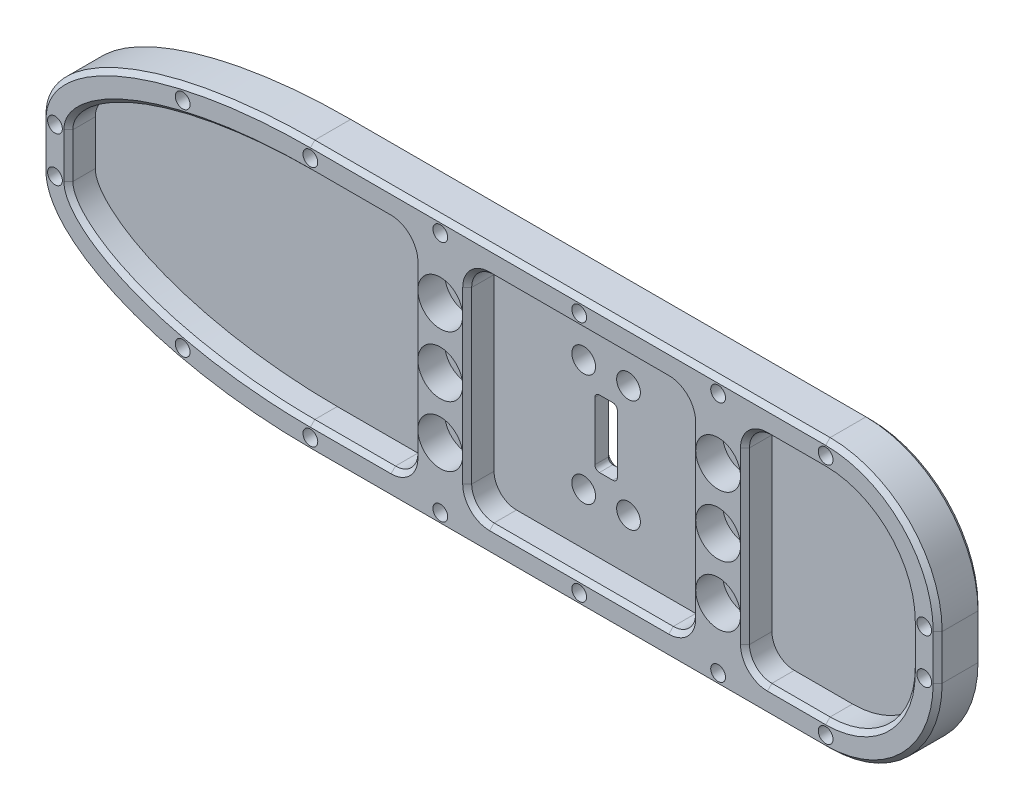
from build123d import *

# Parameters (mm, degrees)
SKETCH_1_W                = 200
SKETCH_1_H                = 60
SKETCH_1_W_2              = 12
SKETCH_1_H_2              = 33
SKETCH_1_W_3              = 5
SKETCH_1_H_3              = 15
EXTRUDE_1_DEPTH           = 10
FILLET_1_R                = 1
FILLET_2_R                = 25
FILLET_3_SIZE             = 60
FILLET_3_SIZE_2           = 25
EXTRUDE_START             = 8
EXTRUDE_2_DEPTH           = 8
SKETCH_3_W                = 50
SKETCH_3_H                = 48
CUT_EXTRUDE_1_DEPTH       = 6
HOLE_WIZARD_1_D           = 5.3
HOLE_WIZARD_1_CBORE_D     = 10
HOLE_WIZARD_1_CBORE_DEPTH = 6
FILLET_4_R                = 5
HOLE_WIZARD_M4_1_D        = 3.3
CHAMFER_1_SIZE            = 1
CHAMFER_2_SIZE            = 1
CHAMFER_3_SIZE            = 1
CUT_EXTRUDE_2_DEPTH       = 2
FILLET_5_R                = 5
CUT_EXTRUDE_4_DEPTH       = 2
FILLET_6_R                = 5
CHAMFER_4_SIZE            = 1
SKETCH_13_R               = 2.65
CUT_EXTRUDE_5_DEPTH       = 144.303873064


# Some blends are built 0.0001 mm under size
with BuildPart() as part:
    # 草图1 → 凸台-拉伸1 (new body)
    with BuildSketch(Plane.XY):
        with Locations((-40, 0)):
            Rectangle(SKETCH_1_W, SKETCH_1_H)
        with Locations((-51, 0)):
            Rectangle(SKETCH_1_W_2, SKETCH_1_H_2, mode=Mode.SUBTRACT)
        with Locations((11, 0)):
            Rectangle(SKETCH_1_W_2, SKETCH_1_H_2, mode=Mode.SUBTRACT)
        with Locations((-20, 0)):
            Rectangle(SKETCH_1_W_3, SKETCH_1_H_3, mode=Mode.SUBTRACT)
    extrude(amount=EXTRUDE_1_DEPTH)

    # 圆角1
    fillet_1_edges = [part.edges().sort_by_distance(p)[0] for p in [
        (-45, -16.5, 5),
        (-45, 16.5, 5),
        (-57, 16.5, 5),
        (-57, -16.5, 5),
        (17, -16.5, 5),
        (17, 16.5, 5),
        (5, 16.5, 5),
        (5, -16.5, 5),
        (-17.5, -7.5, 5),
        (-17.5, 7.5, 5),
        (-22.5, 7.5, 5),
        (-22.5, -7.5, 5),
    ]]
    fillet(fillet_1_edges, radius=FILLET_1_R)

    # 圆角2
    fillet_2_edges = [part.edges().sort_by_distance(p)[0] for p in [
        (60, 30, 5),
        (60, -30, 5),
    ]]
    fillet(fillet_2_edges, radius=FILLET_2_R)

    # 圆角3
    # an asymmetric fillet: 60, 25 mm, written as the material it takes off along each edge
    with BuildSketch(Plane(origin=(-140, -30, -150), x_dir=(1, 0, 0), z_dir=(0, 0, 1))) as fillet_3_piece_1:
        with BuildLine():
            Bezier((FILLET_3_SIZE, 0), (0, 0), (0, FILLET_3_SIZE_2), weights=[1, 0.707106781, 1])
            Line((0, FILLET_3_SIZE_2), (0, 0))
            Line((0, 0), (FILLET_3_SIZE, 0))
        make_face()
    extrude(amount=310, mode=Mode.SUBTRACT)
    with BuildSketch(Plane(origin=(-140, 30, -150), x_dir=(0, -1, 0), z_dir=(0, 0, 1))) as fillet_3_piece_2:
        with BuildLine():
            Bezier((FILLET_3_SIZE_2, 0), (0, 0), (0, FILLET_3_SIZE), weights=[1, 0.707106781, 1])
            Line((0, FILLET_3_SIZE), (0, 0))
            Line((0, 0), (FILLET_3_SIZE_2, 0))
        make_face()
    extrude(amount=310, mode=Mode.SUBTRACT)

    # 草图2 → 凸台-拉伸2 (add)
    with BuildSketch(Plane.XY.offset(2).offset(EXTRUDE_START)):
        with BuildLine():
            Line((6, -16.5), (16, -16.5))
            ThreePointArc((16, -16.5), (16.707106781, -16.207106781), (17, -15.5))
            Line((17, -15.5), (17, 15.5))
            ThreePointArc((17, 15.5), (16.707106781, 16.207106781), (16, 16.5))
            Line((16, 16.5), (6, 16.5))
            ThreePointArc((6, 16.5), (5.292893219, 16.207106781), (5, 15.5))
            Line((5, 15.5), (5, -15.5))
            ThreePointArc((5, -15.5), (5.292893219, -16.207106781), (6, -16.5))
        make_face()
        with BuildLine():
            Line((-45, -15.5), (-45, 15.5))
            ThreePointArc((-45, 15.5), (-45.292893219, 16.207106781), (-46, 16.5))
            Line((-46, 16.5), (-56, 16.5))
            ThreePointArc((-56, 16.5), (-56.707106781, 16.207106781), (-57, 15.5))
            Line((-57, 15.5), (-57, -15.5))
            ThreePointArc((-57, -15.5), (-56.707106781, -16.207106781), (-56, -16.5))
            Line((-56, -16.5), (-46, -16.5))
            ThreePointArc((-46, -16.5), (-45.292893219, -16.207106781), (-45, -15.5))
        make_face()
    extrude(amount=-EXTRUDE_2_DEPTH)

    # 草图3 → 切除-拉伸1 (cut)
    with BuildSketch(Plane.XY.offset(10)):
        with Locations((-20, 0)):
            Rectangle(SKETCH_3_W, SKETCH_3_H)
        with BuildLine():
            Line((-57, 24), (-57, -24))
            Line((-57, -24), (-80, -24))
            add(Edge.make_bspline(
                [(-134, -5), (-134, -5.321566696), (-133.966582352, -5.636753616), (-133.839255599, -6.255579006), (-133.74510808, -6.560649308), (-133.39233917, -7.452769053), (-133.075474111, -7.999573955), (-132.532172356, -8.779869491), (-132.338402095, -9.033829787), (-131.935590882, -9.525137652), (-131.726460148, -9.762430275), (-131.079728935, -10.453376525), (-130.622982271, -10.886307233), (-129.671462644, -11.711010802), (-129.176568621, -12.102652631), (-128.156534756, -12.853199661), (-127.633293959, -13.210532271), (-126.043805661, -14.232141245), (-124.953342805, -14.851558554), (-122.726072359, -15.997632455), (-121.589093234, -16.523945711), (-119.277989623, -17.502224395), (-118.102643683, -17.954494232), (-114.538012443, -19.216567996), (-112.137121221, -19.92641329), (-107.299831175, -21.15523768), (-104.862785448, -21.670739444), (-99.958093605, -22.53725482), (-97.490497947, -22.888539664), (-92.528938987, -23.449373735), (-90.03461426, -23.657415918), (-85.020155365, -23.93301747), (-82.510992182, -24), (-80, -24)],
                knots=[0, 0, 0, 0, 0.015625, 0.015625, 0.03125, 0.03125, 0.0625, 0.0625, 0.078125, 0.078125, 0.09375, 0.09375, 0.125, 0.125, 0.15625, 0.15625, 0.1875, 0.1875, 0.25, 0.25, 0.3125, 0.3125, 0.375, 0.375, 0.5, 0.5, 0.625, 0.625, 0.75, 0.75, 0.875, 0.875, 1, 1, 1, 1], degree=3))
            Line((-134, -5), (-134, 5))
            add(Edge.make_bspline(
                [(-80, 24), (-85.020965946, 24), (-90.014059644, 23.73229491), (-97.458109689, 22.89285334), (-99.932018808, 22.541571769), (-103.629774911, 21.888754838), (-104.860158911, 21.650005684), (-107.316069714, 21.125855356), (-108.540718915, 20.840564599), (-112.187022782, 19.912644301), (-114.588039567, 19.200214751), (-118.12990119, 17.944068394), (-119.300336479, 17.493344196), (-121.61577055, 16.511957603), (-122.759488431, 15.98170001), (-124.435290747, 15.117434598), (-124.987765122, 14.817595504), (-126.078764766, 14.191162489), (-126.618249739, 13.864013602), (-128.203308244, 12.841880038), (-129.216776231, 12.106615101), (-130.634196308, 10.875726542), (-131.08932355, 10.443829769), (-131.951888797, 9.520650276), (-132.357470532, 9.031626278), (-133.078011832, 7.995368985), (-133.39792506, 7.440105439), (-133.74463934, 6.561571019), (-133.83822288, 6.26036066), (-133.966947475, 5.635704804), (-134, 5.319252214), (-134, 5)],
                knots=[0, 0, 0, 0, 0.25, 0.25, 0.375, 0.375, 0.4375, 0.4375, 0.5, 0.5, 0.625, 0.625, 0.6875, 0.6875, 0.75, 0.75, 0.78125, 0.78125, 0.8125, 0.8125, 0.875, 0.875, 0.90625, 0.90625, 0.9375, 0.9375, 0.96875, 0.96875, 0.984375, 0.984375, 1, 1, 1, 1], degree=3))
            Line((-80, 24), (-57, 24))
        make_face()
        with BuildLine():
            Line((17, 24), (17, -24))
            Line((17, -24), (35, -24))
            ThreePointArc((35, -24), (48.435028843, -18.435028843), (54, -5))
            Line((54, -5), (54, 5))
            ThreePointArc((54, 5), (48.435028843, 18.435028843), (35, 24))
            Line((35, 24), (17, 24))
        make_face()
    extrude(amount=-CUT_EXTRUDE_1_DEPTH, mode=Mode.SUBTRACT)

    # 打孔尺寸(%根据)内六角圆柱头螺钉的类型1 (through all)
    with Locations(Plane.XY.offset(10)):
        with Locations((11.000000001, 13.5), (11.000000001, 0), (11.000000001, -13.5), (-50.999999999, -13.5), (-50.999999999, 0), (-50.999999999, 13.5)):
            CounterBoreHole(HOLE_WIZARD_1_D / 2, HOLE_WIZARD_1_CBORE_D / 2, HOLE_WIZARD_1_CBORE_DEPTH)

    # 圆角4
    fillet_4_edges = [part.edges().sort_by_distance(p)[0] for p in [
        (-57, 24, 7),
        (-57, -24, 7),
        (-45, -24, 7),
        (-45, 24, 7),
        (5, -24, 7),
        (5, 24, 7),
        (17, 24, 7),
        (17, -24, 7),
    ]]
    fillet(fillet_4_edges, radius=FILLET_4_R)

    # M4 螺纹孔1 (through all)
    with Locations(Plane.XY.offset(10)):
        with Locations((-137, 5), (-137, -5), (-108.5, -23.92418352), (-108.5, 23.92418352), (-80, 27), (-80, -27), (-51, -27), (-51, 27), (-20, 27), (-20, -27), (11, -27), (11, 27), (35, 27), (57, 5), (57, -5), (35, -27)):
            Hole(HOLE_WIZARD_M4_1_D / 2)

    # 倒角1
    chamfer_1_edges = [part.edges().sort_by_distance(p)[0] for p in [
        (11, 16.5, 0),
        (5, 0, 0),
        (11, -16.5, 0),
        (17, 0, 0),
        (-57, 0, 0),
        (-51, -16.5, 0),
        (-45, 0, 0),
        (-51, 16.5, 0),
        (5.292893219, 16.207106781, 0),
        (5.292893219, -16.207106781, 0),
        (16.707106781, -16.207106781, 0),
        (16.707106781, 16.207106781, 0),
        (-56.707106781, -16.207106781, 0),
        (-45.292893219, -16.207106781, 0),
        (-45.292893219, 16.207106781, 0),
        (-56.707106781, 16.207106781, 0),
    ]]
    chamfer(chamfer_1_edges, length=CHAMFER_1_SIZE)

    # 倒角2
    chamfer_2_edges = [part.edges().sort_by_distance(p)[0] for p in [
        (-20, 7.5, 0),
        (-22.5, 0, 0),
        (-20, -7.5, 0),
        (-17.5, 0, 0),
        (-22.207106781, 7.207106781, 0),
        (-22.207106781, -7.207106781, 0),
        (-17.792893219, -7.207106781, 0),
        (-17.792893219, 7.207106781, 0),
    ]]
    chamfer(chamfer_2_edges, length=CHAMFER_2_SIZE)

    # 倒角3
    chamfer_3_edges = [part.edges().sort_by_distance(p)[0] for p in [
        (60, 0, 0),
        (60, 0, 10),
        (-22.5, 30, 0),
        (52.67766953, 22.67766953, 0),
        (52.67766953, -22.67766953, 0),
        (-22.5, 30, 10),
        (52.67766953, 22.67766953, 10),
        (52.67766953, -22.67766953, 10),
        (-22.5, -30, 0),
        (-22.5, -30, 10),
        (-140, 0, 0),
        (-140, 0, 10),
        (48.435028843, -18.435028843, 10),
        (54, 0, 10),
        (48.435028843, 18.435028843, 10),
        (28.5, 24, 10),
        (-71, -24, 10),
        (-134, 0, 10),
        (-71, 24, 10),
        (-57, 0, 10),
        (-20, -24, 10),
        (-45, 0, 10),
        (-20, 24, 10),
        (5, 0, 10),
        (17, 0, 10),
        (28.5, -24, 10),
        (-58.464466094, 22.535533906, 10),
        (-58.464466094, -22.535533906, 10),
        (-43.535533906, -22.535533906, 10),
        (-43.535533906, 22.535533906, 10),
        (3.535533906, -22.535533906, 10),
        (3.535533906, 22.535533906, 10),
        (18.464466094, 22.535533906, 10),
        (18.464466094, -22.535533906, 10),
    ]]
    chamfer(chamfer_3_edges, length=CHAMFER_3_SIZE - 0.0001)  # a hair under: the kernel refuses the full size

    # 草图10 → 切除-拉伸2 (cut)
    with BuildSketch(Plane(origin=(0, 0, 0), x_dir=(-1, 0, 0), z_dir=(0, 0, -1))):
        with BuildLine():
            Line((62, 19), (62, -19))
            Line((62, -19), (80, -19))
            add(Edge.make_bspline(
                [(80, -19), (84.370979914, -19), (88.721465493, -18.789675165), (95.21375311, -18.130999399), (97.37239507, -17.855469584), (100.601120231, -17.347371367), (101.675813203, -17.16211114), (103.821814581, -16.756856289), (104.894106866, -16.536540027), (108.093094435, -15.820682943), (110.204956717, -15.271667046), (113.334344301, -14.315585242), (114.370929925, -13.974306139), (116.429035367, -13.239748221), (117.451847924, -12.845091019), (119.467192271, -11.993251076), (120.460351588, -11.536107574), (122.40925571, -10.541325528), (123.36597258, -10.003467135), (124.750039667, -9.122515525), (125.203287521, -8.816198935), (126.088034568, -8.169590043), (126.518561609, -7.83014149), (127.338044967, -7.113223965), (127.728569297, -6.735556258), (128.266219413, -6.120939371), (128.437577324, -5.908211719), (128.675280896, -5.5697954), (128.752001926, -5.453371392), (128.856571295, -5.27332548), (128.889645218, -5.212404203), (128.95026717, -5.087753112), (128.979075919, -5.02466406), (129, -4.957567623)],
                knots=[0, 0, 0, 0, 0.25, 0.25, 0.375, 0.375, 0.4375, 0.4375, 0.5, 0.5, 0.625, 0.625, 0.6875, 0.6875, 0.75, 0.75, 0.8125, 0.8125, 0.875, 0.875, 0.90625, 0.90625, 0.9375, 0.9375, 0.96875, 0.96875, 0.984375, 0.984375, 0.9921875, 0.9921875, 0.99609375, 0.99609375, 1, 1, 1, 1], degree=3))
            Line((129, -4.957567623), (129, 4.958126448))
            add(Edge.make_bspline(
                [(129, 4.958126448), (128.979241441, 5.024471856), (128.950146499, 5.087924791), (128.889147522, 5.212585158), (128.855928048, 5.273687889), (128.75152154, 5.453716361), (128.675699843, 5.569315029), (128.437523436, 5.90849568), (128.263391917, 6.1248552), (127.716840042, 6.747728745), (127.322219695, 7.128064473), (126.497307764, 7.847568971), (126.066922171, 8.186629246), (125.17910731, 8.833539611), (124.721281715, 9.141617701), (123.333615319, 10.022378797), (122.383420984, 10.555175003), (120.446830336, 11.542285806), (119.460225083, 11.996147445), (117.458565671, 12.842196856), (116.443441703, 13.234233289), (114.389895255, 13.967797737), (113.350103903, 14.310467627), (110.216020389, 15.268641284), (108.106776336, 15.817073336), (103.856473134, 16.769162822), (101.71509671, 17.171376498), (97.404934617, 17.851078069), (95.235415927, 18.128501438), (88.724933265, 18.789888764), (84.369393261, 19), (80, 19)],
                knots=[0, 0, 0, 0, 0.00390625, 0.00390625, 0.0078125, 0.0078125, 0.015625, 0.015625, 0.03125, 0.03125, 0.0625, 0.0625, 0.09375, 0.09375, 0.125, 0.125, 0.1875, 0.1875, 0.25, 0.25, 0.3125, 0.3125, 0.375, 0.375, 0.5, 0.5, 0.625, 0.625, 0.75, 0.75, 1, 1, 1, 1], degree=3))
            Line((80, 19), (62, 19))
        make_face()
    extrude(amount=-CUT_EXTRUDE_2_DEPTH, mode=Mode.SUBTRACT)

    # 圆角5
    # the kernel refuses this fillet: 5 mm, written as the material it adds along each edge
    with BuildSketch(Plane(origin=(-62, 19, 0), x_dir=(-1, 0, 0), z_dir=(0, 0, 1))) as fillet_5_piece_1:
        with BuildLine():
            CenterArc((FILLET_5_R, FILLET_5_R), FILLET_5_R, 180, 90)
            Line((0, FILLET_5_R), (-FILLET_5_R * 0.0199999999999, FILLET_5_R))
            Line((-FILLET_5_R * 0.0199999999999, FILLET_5_R), (-FILLET_5_R * 0.02, -FILLET_5_R * 0.02))
            Line((-FILLET_5_R * 0.02, -FILLET_5_R * 0.02), (FILLET_5_R, -FILLET_5_R * 0.02))
            Line((FILLET_5_R, -FILLET_5_R * 0.02), (FILLET_5_R, 0))
        make_face()
    extrude(amount=2)
    with BuildSketch(Plane(origin=(-129, -4.957567623, 0), x_dir=(0, 1, 0), z_dir=(0, 0, 1))) as fillet_5_piece_2:
        with BuildLine():
            CenterArc((1.583947859, -5), FILLET_5_R, 90, 45.710093303)
            Line((-1.995130923, -1.508554014), (-2.066712498, -1.438725094))
            ThreePointArc((-2.066712498, -1.438725094), (-1.132688591, -0.585204473), (-0.029771036, 0.095465624))
            Line((-0.029771036, 0.095465624), (0, 0.1))
            Line((0, 0.1), (1.583947859, 0.1))
            Line((1.583947859, 0.1), (1.583947859, 0))
        make_face()
    extrude(amount=2)
    with BuildSketch(Plane(origin=(-129, 4.958126448, 0), x_dir=(0.6032154166790661, 0.7975783103123485, 0), z_dir=(0, 0, 1))) as fillet_5_piece_3:
        with BuildLine():
            CenterArc((1.752190359, -4.94378008), FILLET_5_R, 81.399860099, 45.700673573)
            Line((-1.263886724, -0.955888528), (-1.324208266, -0.876130697))
            Line((-1.324208266, -0.876130697), (-0.060321542, 0.079757831))
            Line((-0.060321542, 0.079757831), (-0.033752829, 0.094131539))
            ThreePointArc((-0.033752829, 0.094131539), (1.25570174, 0.216274256), (2.514832924, 0.098875602))
            Line((2.514832924, 0.098875602), (2.499879148, 0))
        make_face()
    extrude(amount=2)
    with BuildSketch(Plane(origin=(-62, -19, 0), x_dir=(-1, 0, 0), z_dir=(0, 0, 1))) as fillet_5_piece_4:
        with BuildLine():
            CenterArc((FILLET_5_R, -FILLET_5_R), FILLET_5_R, 90, 90)
            Line((0, -FILLET_5_R), (-FILLET_5_R * 0.02, -FILLET_5_R))
            Line((-FILLET_5_R * 0.02, -FILLET_5_R), (-FILLET_5_R * 0.02, FILLET_5_R * 0.02))
            Line((-FILLET_5_R * 0.02, FILLET_5_R * 0.02), (FILLET_5_R, FILLET_5_R * 0.02))
            Line((FILLET_5_R, FILLET_5_R * 0.02), (FILLET_5_R, 0))
        make_face()
    extrude(amount=2)

    # 草图12 → 切除-拉伸4 (cut)
    with BuildSketch(Plane(origin=(0, 0, 0), x_dir=(-1, 0, 0), z_dir=(0, 0, -1))):
        with BuildLine():
            Line((-22, 19), (-35, 19))
            ThreePointArc((-35, 19), (-44.899494937, 14.899494937), (-49, 5))
            Line((-49, 5), (-49, -5))
            ThreePointArc((-49, -5), (-44.899494937, -14.899494937), (-35, -19))
            Line((-35, -19), (-22, -19))
            Line((-22, -19), (-22, 19))
        make_face()
    extrude(amount=-CUT_EXTRUDE_4_DEPTH, mode=Mode.SUBTRACT)

    # 圆角6
    fillet_6_edges = [part.edges().sort_by_distance(p)[0] for p in [
        (22, 19, 1),
        (22, -19, 1),
    ]]
    fillet(fillet_6_edges, radius=FILLET_6_R)

    # 倒角4
    chamfer_4_edges = [part.edges().sort_by_distance(p)[0] for p in [
        (-63.464466094, -17.535533906, 0),
        (-62, 0, 0),
        (-73.5, -19, 0),
        (-63.464466094, 17.535533906, 0),
        (-104.770399819, -16.556191839, 0),
        (-73.5, 19, 0),
        (-128.607452112, -5.31562518, 0),
        (-104.770857007, 16.556060598, 0),
        (-129, -7.4325e-05, 0),
        (-128.607611734, 5.315097778, 0),
        (49, 0, 0),
        (44.899494937, -14.899494937, 0),
        (44.899494937, 14.899494937, 0),
        (31, -19, 0),
        (31, 19, 0),
        (23.464466094, -17.535533906, 0),
        (23.464466094, 17.535533906, 0),
        (22, 0, 0),
    ]]
    chamfer(chamfer_4_edges, length=CHAMFER_4_SIZE)

    # 草图13 → 切除-拉伸5 (cut, through all)
    with BuildSketch(Plane.XY.offset(4)):
        with Locations((-25, 12.5)):
            Circle(SKETCH_13_R)
        with Locations((-15, 12.5)):
            Circle(SKETCH_13_R)
        with Locations((-15, -12.5)):
            Circle(SKETCH_13_R)
        with Locations((-25, -12.5)):
            Circle(SKETCH_13_R)
    extrude(amount=-CUT_EXTRUDE_5_DEPTH, mode=Mode.SUBTRACT)


solid = part.part
